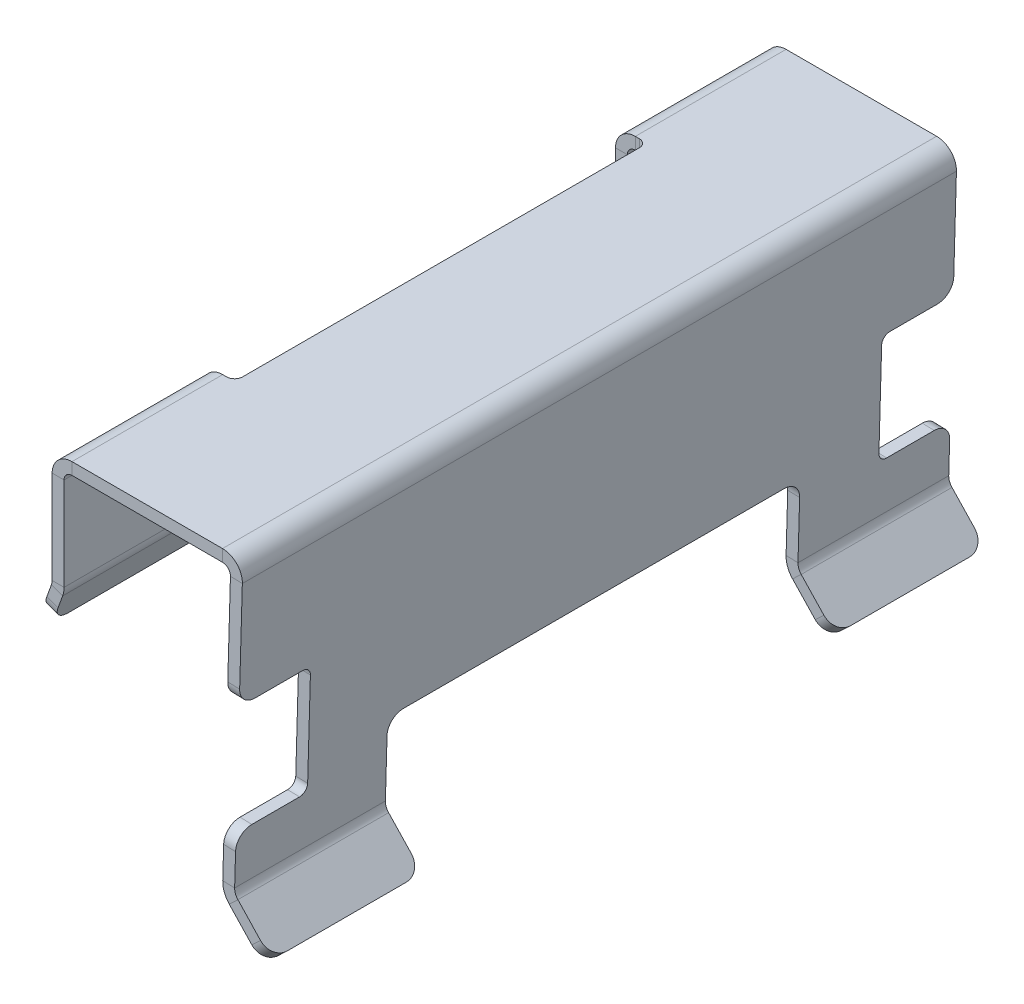
from build123d import *

# Parameters (mm, degrees)
BASE_FLANGE1_DEPTH = 22.5
CUT_EXTRUDE1_START = -9.35
CUT_EXTRUDE1_DEPTH = 9.35
CUT_EXTRUDE2_DEPTH = 28.952537171
FILLET_R1_R        = 1


# Read off the part's stored shape, not the designer's step: Cut-Extrude1
# Sheet-metal steps are written as plain solids
with BuildPart() as part:
    # Sketch1 → Base-Flange1 (new, symmetric)
    with BuildSketch(Plane.XY):
        with BuildLine():
            Line((-0.718242301, 0), (-0.090461069, 1.72481476))
            ThreePointArc((-0.090461069, 1.72481476), (-0.02278837, 1.977372708), (0, 2.237844975))
            Line((0, 2.237844975), (0, 8.1))
            ThreePointArc((0, 8.1), (0.146446609, 8.453553391), (0.5, 8.6))
            Line((0.5, 8.6), (9.985419886, 8.6))
            ThreePointArc((9.985419886, 8.6), (10.344017022, 8.448436644), (10.485213415, 8.085632378))
            Line((10.485213415, 8.085632378), (10.000619414, -8.771503263))
            ThreePointArc((10.000619414, -8.771503263), (10.098258212, -9.348572383), (10.409299492, -9.84434998))
            Line((10.409299492, -9.84434998), (12.522800458, -12.082961625))
            Line((12.522800458, -12.082961625), (13.068150712, -11.568089698))
            Line((13.068150712, -11.568089698), (10.954649746, -9.329478054))
            ThreePointArc((10.954649746, -9.329478054), (10.799129106, -9.081589256), (10.750309707, -8.793054696))
            Line((10.750309707, -8.793054696), (11.234903709, 8.064080946))
            ThreePointArc((11.234903709, 8.064080946), (10.881912725, 8.971091609), (9.985419886, 9.35))
            Line((9.985419886, 9.35), (0.5, 9.35))
            ThreePointArc((0.5, 9.35), (-0.383883476, 8.983883476), (-0.75, 8.1))
            Line((-0.75, 8.1), (-0.75, 2.237844975))
            ThreePointArc((-0.75, 2.237844975), (-0.761394185, 2.107608841), (-0.795230534, 1.981329867))
            Line((-0.795230534, 1.981329867), (-1.423011767, 0.256515107))
            Line((-1.423011767, 0.256515107), (-0.718242301, 0))
        make_face()
    extrude(amount=BASE_FLANGE1_DEPTH, both=True)

    # Cut-Extrude1 outline → Cut-Extrude1 (cut)
    with BuildSketch(Plane(origin=(0, 9.35, 0), x_dir=(-1, 0, 0), z_dir=(0, 1, 0)).offset(CUT_EXTRUDE1_START)):
        with BuildLine():
            ThreePointArc((-0.75, 13), (-1.103553391, 12.853553391), (-1.25, 12.5))
            Line((-1.25, 12.5), (-1.25, -12.5))
            ThreePointArc((-1.25, -12.5), (-1.103553391, -12.853553391), (-0.75, -13))
            Line((-0.75, -13), (3, -13))
            Line((3, -13), (3, 13))
            Line((3, 13), (-0.75, 13))
        make_face()
    extrude(amount=CUT_EXTRUDE1_DEPTH, mode=Mode.SUBTRACT)

    # Sketch5 → Cut-Extrude2 (cut, through all)
    with BuildSketch(Plane(origin=(10.244308957, -0.294494318, 0), x_dir=(0, 0, -1), z_dir=(0.999587057638364, -0.02873524320200468, 0))):
        with BuildLine():
            Line((-22.5, 1.533588636), (-18.5, 1.533588636))
            ThreePointArc((-18.5, 1.533588636), (-18.146446609, 1.387142026), (-18, 1.033588636))
            Line((-18, 1.033588636), (-18, -4.966411364))
            ThreePointArc((-18, -4.966411364), (-18.146446609, -5.319964755), (-18.5, -5.466411364))
            Line((-18.5, -5.466411364), (-22.5, -5.466411364))
            Line((-22.5, -5.466411364), (-22.5, 1.533588636))
        make_face()
        with BuildLine():
            Line((18, 1.033588636), (18, -4.966411364))
            ThreePointArc((18, -4.966411364), (18.146446609, -5.319964755), (18.5, -5.466411364))
            Line((18.5, -5.466411364), (22.5, -5.466411364))
            Line((22.5, -5.466411364), (22.5, 1.533588636))
            Line((22.5, 1.533588636), (18.5, 1.533588636))
            ThreePointArc((18.5, 1.533588636), (18.146446609, 1.387142026), (18, 1.033588636))
        make_face()
        with BuildLine():
            Line((-12, -3.866411364), (12, -3.866411364))
            ThreePointArc((12, -3.866411364), (12.707106781, -4.159304583), (13, -4.866411364))
            Line((13, -4.866411364), (13, -11.718126341))
            Line((13, -11.718126341), (-13, -11.718126341))
            Line((-13, -11.718126341), (-13, -4.866411364))
            ThreePointArc((-13, -4.866411364), (-12.707106781, -4.159304583), (-12, -3.866411364))
        make_face()
    extrude(amount=CUT_EXTRUDE2_DEPTH, mode=Mode.SUBTRACT)

    # R1
    fillet_r1_edges = [part.edges().sort_by_distance(p)[0] for p in [
        (10.663222146, 1.227685317, -22.5),
        (10.462075444, -5.769424086, -22.5),
        (-1.070627034, 0.128257554, -22.5),
        (12.795475585, -11.825525661, 13),
        (12.795475585, -11.825525661, -13),
        (10.663222146, 1.227685317, 22.5),
        (10.462075444, -5.769424086, 22.5),
        (12.795475585, -11.825525661, -22.5),
        (-1.070627034, 0.128257554, 22.5),
        (12.795475585, -11.825525661, 22.5),
        (-1.070627034, 0.128257554, 13),
        (-1.070627034, 0.128257554, -13),
    ]]
    fillet(fillet_r1_edges, radius=FILLET_R1_R)


solid = part.part
